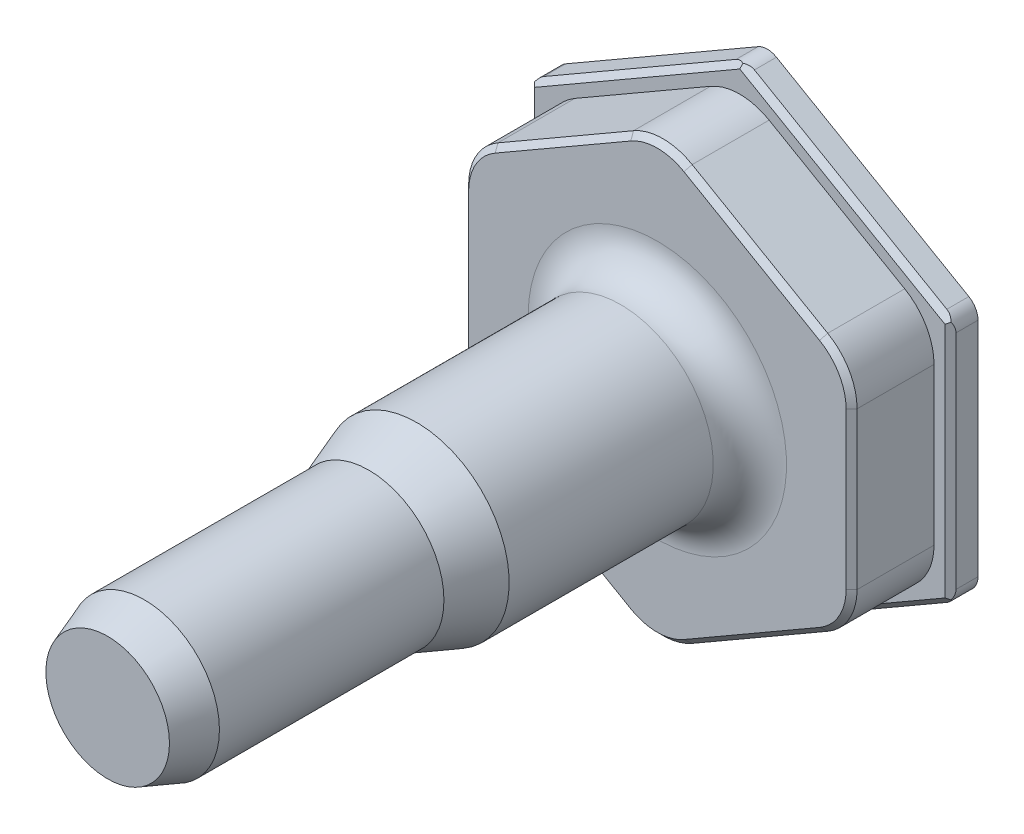
from build123d import *

# Parameters (mm, degrees)
BOSS_EXTRUDE1_DEPTH  = 1.5
SKETCH1_8_R          = 4.1
BOSS_EXTRUDE3_DEPTH  = 36
SKETCH1_9_R          = 5.05
BOSS_EXTRUDE4_DEPTH  = 19
SHELL1_START         = 2
SHELL1_OUTLINE_R     = 2.1
SHELL1_DEPTH         = 32
SHELL1_2_OUTLINE_R   = 3.05
SHELL1_2_OUTLINE_R_2 = 2.1
SHELL1_2_DEPTH       = 15
SKETCH1_10_R         = 3.25
CUT_EXTRUDE1_DEPTH   = 17
SKETCH1_3_R          = 3.25
BOSS_EXTRUDE2_DEPTH  = 6
CHAMFER1_SIZE        = 2
CHAMFER1_SIZE2       = 0.727940469
CHAMFER2_SIZE        = 2.747477419
CHAMFER2_SIZE_2      = 1
CHAMFER3_SIZE        = 1.212435565
CHAMFER3_SIZE_2      = 0.7
CHAMFER6_SIZE        = 0.3
FILLET1_R            = 3.2
CHAMFER5_SIZE        = 0.3
FILLET2_R            = 1
FILLET3_R            = 2


# Read off the part's stored shape, not the designer's step: Shell1
with BuildPart() as part:
    # Sketch1 → Boss-Extrude1 (new body)
    with BuildSketch(Plane.XY):
        Polygon((-11.5, 6.639528096), (0, 13.279056191), (11.5, 6.639528096), (11.5, -6.639528096), (0, -13.279056191), (-11.5, -6.639528096), align=None)
    extrude(amount=BOSS_EXTRUDE1_DEPTH)

    # Sketch1<8> → Boss-Extrude3 (add)
    with BuildSketch(Plane.XY):
        with Locations(Location((0, 0, 0), (0, 0, 180))):
            Circle(SKETCH1_8_R)
    extrude(amount=BOSS_EXTRUDE3_DEPTH)

    # Sketch1<9> → Boss-Extrude4 (add)
    with BuildSketch(Plane.XY):
        with Locations(Location((0, 0, 0), (0, 0, 180))):
            Circle(SKETCH1_9_R)
    extrude(amount=BOSS_EXTRUDE4_DEPTH)

    # Shell1 outline → Shell1 (cut)
    with BuildSketch(Plane.XY.offset(SHELL1_START)):
        Circle(SHELL1_OUTLINE_R)
    extrude(amount=SHELL1_DEPTH, mode=Mode.SUBTRACT)

    # Shell1 2 outline → Shell1 2 (cut)
    with BuildSketch(Plane.XY.offset(SHELL1_START)):
        Circle(SHELL1_2_OUTLINE_R)
        Circle(SHELL1_2_OUTLINE_R_2, mode=Mode.SUBTRACT)
    extrude(amount=SHELL1_2_DEPTH, mode=Mode.SUBTRACT)

    # Sketch1<10> → Cut-Extrude1 (cut)
    with BuildSketch(Plane.XY):
        Circle(SKETCH1_10_R)
    extrude(amount=CUT_EXTRUDE1_DEPTH, mode=Mode.SUBTRACT)

    # Sketch1<3> → Boss-Extrude2 (add)
    with BuildSketch(Plane.XY):
        Polygon((0, 12.239825707), (10.6, 6.119912853), (10.6, -6.119912853), (0, -12.239825707), (-10.6, -6.119912853), (-10.6, 6.119912853), align=None)
        Circle(SKETCH1_3_R, mode=Mode.SUBTRACT)
    extrude(amount=BOSS_EXTRUDE2_DEPTH)

    # Chamfer1
    chamfer1_edges = [part.edges().sort_by_distance(p)[0] for p in [
        (4.1, 0, 36),
    ]]
    chamfer1_side = [part.faces().sort_by_distance(p)[0] for p in [
        (4.1, 0, 27.5),
    ]]
    chamfer(chamfer1_edges, length=CHAMFER1_SIZE, length2=CHAMFER1_SIZE2, reference=chamfer1_side[0])

    # Chamfer2
    # the kernel refuses this chamfer: 2.747477419, 1 mm, written as the material it adds along each edge
    with BuildSketch(Plane(origin=(0, 0, 19), x_dir=(-1, 0, 0), z_dir=(0, -1, 0))) as chamfer2_piece_1_section:
        Polygon((4.1, -CHAMFER2_SIZE), (4.1 + CHAMFER2_SIZE_2, 0), (4.1, 0), align=None)
    chamfer2_piece_1 = revolve(axis=Axis((0, 0, 19), (0, 0, -1)), mode=Mode.PRIVATE)
    chamfer2_piece_1 = chamfer2_piece_1 & Plane(origin=(0, 0, 20.481947897), x_dir=(-1, 0, 0), z_dir=(0, 0, -1)) * Cylinder(5.05, 21, mode=Mode.PRIVATE)
    add(chamfer2_piece_1)

    # Chamfer3
    # the kernel refuses this chamfer: 1.212435565, 0.7 mm, written as the material it takes off along each edge
    with BuildSketch(Plane(origin=(0, 0, 17), x_dir=(1, 0, 0), z_dir=(0, -1, 0))) as chamfer3_piece_1_section:
        Polygon((2.1 + CHAMFER3_SIZE, 0), (2.1, CHAMFER3_SIZE_2), (2.1, 0), align=None)
    chamfer3_piece_1 = revolve(axis=Axis((0, 0, 17), (0, 0, 1)), mode=Mode.PRIVATE)
    chamfer3_piece_1 = chamfer3_piece_1 & Plane(origin=(0, 0, 17.363214185), x_dir=(1, 0, 0), z_dir=(0, 0, -1)) * Cylinder(3.25, 14, mode=Mode.PRIVATE)
    add(chamfer3_piece_1, mode=Mode.SUBTRACT)

    # Chamfer6
    chamfer6_edges = [part.edges().sort_by_distance(p)[0] for p in [
        (-3.25, 0, 0),
    ]]
    chamfer(chamfer6_edges, length=CHAMFER6_SIZE)

    # Fillet1
    fillet1_edges = [part.edges().sort_by_distance(p)[0] for p in [
        (-10.6, -6.119912853, 3.75),
        (0, -12.239825707, 3.75),
        (10.6, -6.119912853, 3.75),
        (10.6, 6.119912853, 3.75),
        (0, 12.239825707, 3.75),
        (-10.6, 6.119912853, 3.75),
    ]]
    fillet(fillet1_edges, radius=FILLET1_R)

    # Chamfer5
    chamfer5_edges = [part.edges().sort_by_distance(p)[0] for p in [
        (-5.3, -9.17986928, 6),
        (5.3, 9.17986928, 6),
        (-5.3, 9.17986928, 6),
        (-10.6, 0, 6),
        (10.171281292, 5.872391992, 6),
        (0, 11.744783984, 6),
        (-10.171281292, 5.872391992, 6),
        (-10.171281292, -5.872391992, 6),
        (0, -11.744783984, 6),
        (10.171281292, -5.872391992, 6),
        (5.75, 9.959292144, 1.5),
        (11.5, 0, 1.5),
        (5.75, -9.959292144, 1.5),
        (-5.75, -9.959292144, 1.5),
        (-11.5, 0, 1.5),
        (-5.75, 9.959292144, 1.5),
        (10.6, 0, 6),
        (5.3, -9.17986928, 6),
    ]]
    chamfer(chamfer5_edges, length=CHAMFER5_SIZE)

    # Fillet2
    fillet2_edges = [part.edges().sort_by_distance(p)[0] for p in [
        (11.5, 6.639528096, 0.6),
        (11.5, -6.639528096, 0.6),
        (0, -13.279056191, 0.6),
        (-11.5, -6.639528096, 0.6),
        (-11.5, 6.639528096, 0.6),
        (0, 13.279056191, 0.6),
    ]]
    fillet(fillet2_edges, radius=FILLET2_R)

    # Fillet3
    fillet3_edges = [part.edges().sort_by_distance(p)[0] for p in [
        (5.05, 0, 6),
    ]]
    fillet(fillet3_edges, radius=FILLET3_R)


solid = part.part
